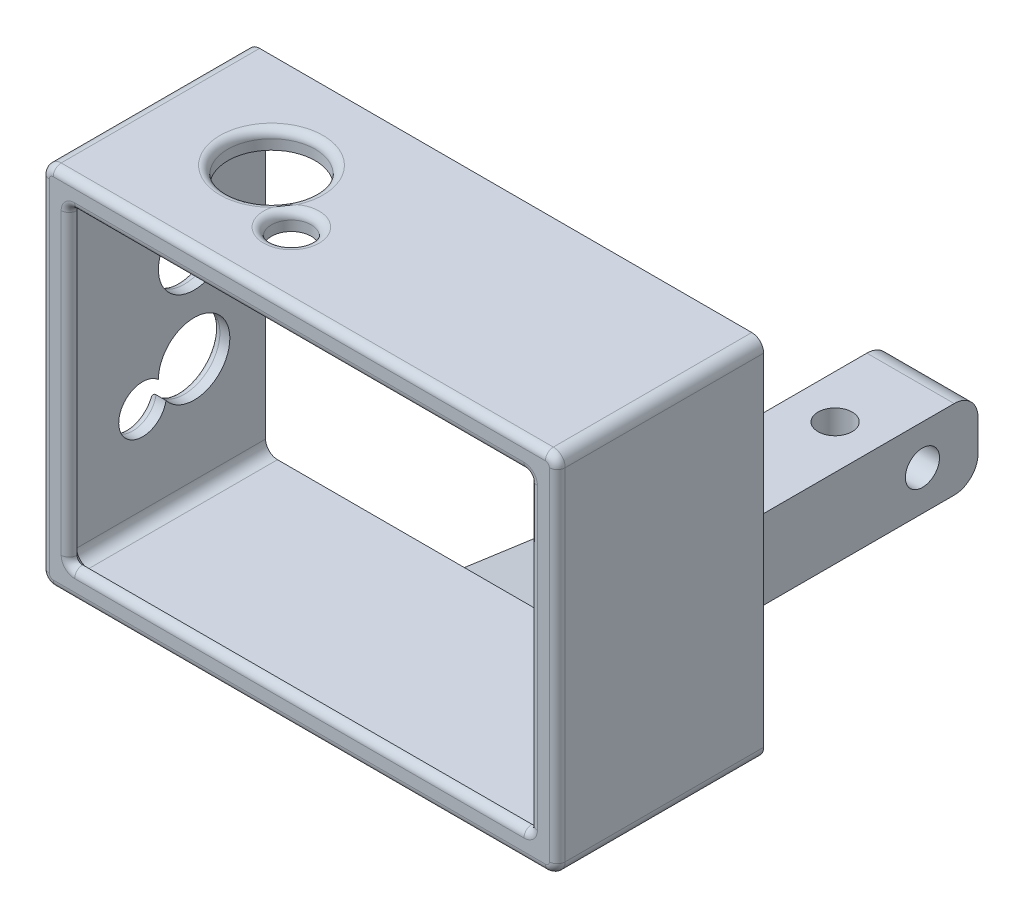
from build123d import *

# Parameters (mm, degrees)
SKETCH1_W           = 65
SKETCH1_H           = 46
BOSS_EXTRUDE1_DEPTH = 26
SKETCH2_W           = 60.5
SKETCH2_H           = 41.5
CUT_EXTRUDE1_DEPTH  = 25
SKETCH3_W           = 58
SKETCH3_H           = 39
CUT_EXTRUDE2_DEPTH  = 2
SKETCH4_R           = 5.5
CUT_EXTRUDE3_DEPTH  = 3
SKETCH6_R           = 4.5
CUT_EXTRUDE4_DEPTH  = 2.5
SKETCH7_R           = 3
CUT_EXTRUDE5_DEPTH  = 2.5
SKETCH8_R           = 2.5
CUT_EXTRUDE6_DEPTH  = 2.5
FILLET1_R           = 1
FILLET2_R           = 1.5
FILLET4_R           = 0.7
CHAMFER2_SIZE       = 1.2
SKETCH9_W           = 11
SKETCH9_H           = 10
BOSS_EXTRUDE2_DEPTH = 80
SKETCH10_R          = 2.15
CUT_EXTRUDE7_DEPTH  = 11
FILLET5_R           = 3
CHAMFER4_SIZE       = 2
CHAMFER4_SIZE2      = 14.230739445
SKETCH12_W          = 11
SKETCH12_H          = 10
CUT_EXTRUDE9_DEPTH  = 10
CHAMFER5_SIZE2      = 10
CHAMFER5_SIZE       = 37.320508076
FILLET10_R          = 1
SKETCH13_R          = 2.15
CUT_EXTRUDE10_DEPTH = 10
FILLET11_R          = 11


# Some blends are built 0.0001 mm under size
with BuildPart() as part:
    # Sketch1 → Boss-Extrude1 (new body)
    with BuildSketch(Plane.XY):
        Rectangle(SKETCH1_W, SKETCH1_H)
    extrude(amount=BOSS_EXTRUDE1_DEPTH)

    # Sketch2 → Cut-Extrude1 (cut)
    with BuildSketch(Plane(origin=(0, 0, 0), x_dir=(-1, 0, 0), z_dir=(0, 0, -1))):
        Rectangle(SKETCH2_W, SKETCH2_H)
    extrude(amount=-CUT_EXTRUDE1_DEPTH, mode=Mode.SUBTRACT)

    # Sketch3 → Cut-Extrude2 (cut)
    with BuildSketch(Plane(origin=(0, 0, 25), x_dir=(-1, 0, 0), z_dir=(0, 0, -1))):
        Rectangle(SKETCH3_W, SKETCH3_H)
    extrude(amount=-CUT_EXTRUDE2_DEPTH, mode=Mode.SUBTRACT)

    # Sketch4 → Cut-Extrude3 (cut)
    with BuildSketch(Plane(origin=(0, 23, 0), x_dir=(1, 0, 0), z_dir=(0, 1, 0))):
        with Locations(Location((-17.5, -12, 0), (0, 0, 270))):
            Circle(SKETCH4_R)
    extrude(amount=-CUT_EXTRUDE3_DEPTH, mode=Mode.SUBTRACT)

    # Sketch6 → Cut-Extrude4 (cut)
    with BuildSketch(Plane.ZY.offset(32.5)):
        with Locations(Location((9, 6, 0), (0, 0, 270))):
            Circle(SKETCH6_R)
        with Locations(Location((9, -6, 0), (0, 0, 270))):
            Circle(SKETCH6_R)
    extrude(amount=-CUT_EXTRUDE4_DEPTH, mode=Mode.SUBTRACT)

    # Sketch7 → Cut-Extrude5 (cut)
    with BuildSketch(Plane.ZY.offset(32.5)):
        with Locations((15.5, -8.25)):
            Circle(SKETCH7_R)
    extrude(amount=-CUT_EXTRUDE5_DEPTH, mode=Mode.SUBTRACT)

    # Sketch8 → Cut-Extrude6 (cut)
    with BuildSketch(Plane(origin=(0, 23, 0), x_dir=(1, 0, 0), z_dir=(0, 1, 0))):
        with Locations(Location((-9.5, -17.5, 0), (0, 0, 270))):
            Circle(SKETCH8_R)
    extrude(amount=-CUT_EXTRUDE6_DEPTH, mode=Mode.SUBTRACT)

    # Fillet1
    # the kernel refuses this fillet: 1 mm, written as the material it takes off along each edge
    with BuildSketch(Plane(origin=(-17.5, 23, 12), x_dir=(0, 0, 1), z_dir=(-1, 0, 0))) as fillet1_piece_1:
        with BuildLine():
            CenterArc((5.5 + FILLET1_R, -FILLET1_R), FILLET1_R, 90, 90)
            Line((5.5, -FILLET1_R), (5.5, 0))
            Line((5.5, 0), (5.5 + FILLET1_R, 0))
        make_face()
    revolve(axis=Axis((-17.5, 23, 12), (0, 1, 0)), mode=Mode.SUBTRACT)
    with BuildSketch(Plane(origin=(-32.5, 6, 9), x_dir=(0, -1, 0), z_dir=(0, 0, -1))) as fillet1_piece_2:
        with BuildLine():
            CenterArc((4.5 + FILLET1_R, -FILLET1_R), FILLET1_R, 90, 90)
            Line((4.5, -FILLET1_R), (4.5, 0))
            Line((4.5, 0), (4.5 + FILLET1_R, 0))
        make_face()
    revolve(axis=Axis((-32.5, 6, 9), (-1, 0, 0)), mode=Mode.SUBTRACT)
    with BuildSketch(Plane(origin=(-32.5, -6, 9), x_dir=(0, -0.33007770608121106, 0.9439537636707455), z_dir=(0, 0.9439537636707455, 0.33007770608121106))) as fillet1_piece_3:
        with BuildLine():
            CenterArc((4.5 + FILLET1_R, FILLET1_R), FILLET1_R, 180, 90)
            Line((4.5, FILLET1_R), (4.5, 0))
            Line((4.5, 0), (4.5 + FILLET1_R, 0))
        make_face()
    revolve(axis=Axis((-32.5, -6, 9), (1, 0, 0)), revolution_arc=359.64, mode=Mode.SUBTRACT)
    with BuildSketch(Plane(origin=(-32.5, -8.25, 15.5), x_dir=(0, 0.3300777060812122, -0.9439537636707451), z_dir=(0, -0.9439537636707451, -0.3300777060812122))) as fillet1_piece_4:
        with BuildLine():
            CenterArc((3 + FILLET1_R, FILLET1_R), FILLET1_R, 180, 90)
            Line((3, FILLET1_R), (3, 0))
            Line((3, 0), (3 + FILLET1_R, 0))
        make_face()
    revolve(axis=Axis((-32.5, -8.25, 15.5), (1, 0, 0)), revolution_arc=359.64, mode=Mode.SUBTRACT)
    with BuildSketch(Plane(origin=(-9.5, 23, 17.5), x_dir=(0, 0, 1), z_dir=(-1, 0, 0))) as fillet1_piece_5:
        with BuildLine():
            CenterArc((2.5 + FILLET1_R, -FILLET1_R), FILLET1_R, 90, 90)
            Line((2.5, -FILLET1_R), (2.5, 0))
            Line((2.5, 0), (2.5 + FILLET1_R, 0))
        make_face()
    revolve(axis=Axis((-9.5, 23, 17.5), (0, 1, 0)), mode=Mode.SUBTRACT)

    # Fillet2
    fillet2_edges = [part.edges().sort_by_distance(p)[0] for p in [
        (-30.25, 20.75, 12.5),
        (-30.25, -20.75, 12.5),
        (30.25, -20.75, 12.5),
        (30.25, 20.75, 12.5),
        (32.5, -23, 13),
        (-32.5, -23, 13),
        (-32.5, 23, 13),
        (32.5, 23, 13),
    ]]
    fillet(fillet2_edges, radius=FILLET2_R)

    # Fillet4
    fillet4_edges = [part.edges().sort_by_distance(p)[0] for p in [
        (-29, 19.5, 25.5),
        (-29, -19.5, 25.5),
        (29, -19.5, 25.5),
        (29, 19.5, 25.5),
    ]]
    fillet(fillet4_edges, radius=FILLET4_R)

    # Chamfer2
    chamfer2_edges = [part.edges().sort_by_distance(p)[0] for p in [
        (-29.810660172, 20.310660172, 25),
        (-29.810660172, -20.310660172, 25),
        (29.810660172, -20.310660172, 25),
        (0, -20.75, 25),
        (30.25, 0, 25),
        (-30.25, 0, 25),
        (0, 20.75, 25),
        (29.810660172, 20.310660172, 25),
    ]]
    chamfer(chamfer2_edges, length=CHAMFER2_SIZE)

    # Sketch9 → Boss-Extrude2 (add)
    with BuildSketch(Plane.XY.offset(26)):
        with Locations((0, -28)):
            Rectangle(SKETCH9_W, SKETCH9_H)
    extrude(amount=-BOSS_EXTRUDE2_DEPTH)

    # Sketch10 → Cut-Extrude7 (cut)
    with BuildSketch(Plane.ZY.offset(5.5)):
        with Locations(Location((-47, -28, 0), (0, 0, 270))):
            Circle(SKETCH10_R)
    extrude(amount=-CUT_EXTRUDE7_DEPTH, mode=Mode.SUBTRACT)

    # Fillet5
    fillet5_edges = [part.edges().sort_by_distance(p)[0] for p in [
        (0, -23, -54),
        (0, -33, -54),
    ]]
    fillet(fillet5_edges, radius=FILLET5_R)

    # Chamfer4
    chamfer4_edges = [part.edges().sort_by_distance(p)[0] for p in [
        (0, -23, 0),
    ]]
    chamfer4_side = [part.faces().sort_by_distance(p)[0] for p in [
        (0, 22.203696038, 0),
    ]]
    chamfer(chamfer4_edges, length=CHAMFER4_SIZE, length2=CHAMFER4_SIZE2, reference=chamfer4_side[0])

    # Sketch12 → Cut-Extrude9 (cut)
    with BuildSketch(Plane.XZ.offset(33)):
        with Locations((0, 21)):
            Rectangle(SKETCH12_W, SKETCH12_H)
    extrude(amount=-CUT_EXTRUDE9_DEPTH, mode=Mode.SUBTRACT)

    # Chamfer5
    chamfer5_edges = [part.edges().sort_by_distance(p)[0] for p in [
        (0, -33, 16),
    ]]
    chamfer5_side = [part.faces().sort_by_distance(p)[0] for p in [
        (0, -33, 15.8),
    ]]
    chamfer(chamfer5_edges, length=CHAMFER5_SIZE - 0.0001, length2=CHAMFER5_SIZE2 - 0.0001, reference=chamfer5_side[0])  # a hair under: the kernel refuses the full size

    # Fillet10
    fillet10_edges = [part.edges().sort_by_distance(p)[0] for p in [
        (28.794974747, -19.294974747, 26),
        (29, 0, 26),
        (28.794974747, 19.294974747, 26),
        (0, 19.5, 26),
        (-28.794974747, 19.294974747, 26),
        (-29, 0, 26),
        (-28.794974747, -19.294974747, 26),
        (0, -19.5, 26),
        (-32.060660172, -22.560660172, 26),
        (-32.5, 0, 26),
        (-32.060660172, 22.560660172, 26),
        (0, 23, 26),
        (32.060660172, 22.560660172, 26),
        (32.5, 0, 26),
        (32.060660172, -22.560660172, 26),
        (0, -23, 26),
    ]]
    fillet(fillet10_edges, radius=FILLET10_R - 0.0001)  # a hair under: the kernel refuses the full size

    # Sketch13 → Cut-Extrude10 (cut)
    with BuildSketch(Plane(origin=(0, -23, 0), x_dir=(1, 0, 0), z_dir=(0, 1, 0))):
        with Locations(Location((0, 41.5, 0), (0, 0, 270))):
            Circle(SKETCH13_R)
    extrude(amount=-CUT_EXTRUDE10_DEPTH, mode=Mode.SUBTRACT)

    # Fillet11
    fillet11_edges = [part.edges().sort_by_distance(p)[0] for p in [
        (0, -23, -14.230739445),
        (0, -33, -21.320408076),
    ]]
    fillet(fillet11_edges, radius=FILLET11_R)


solid = part.part
